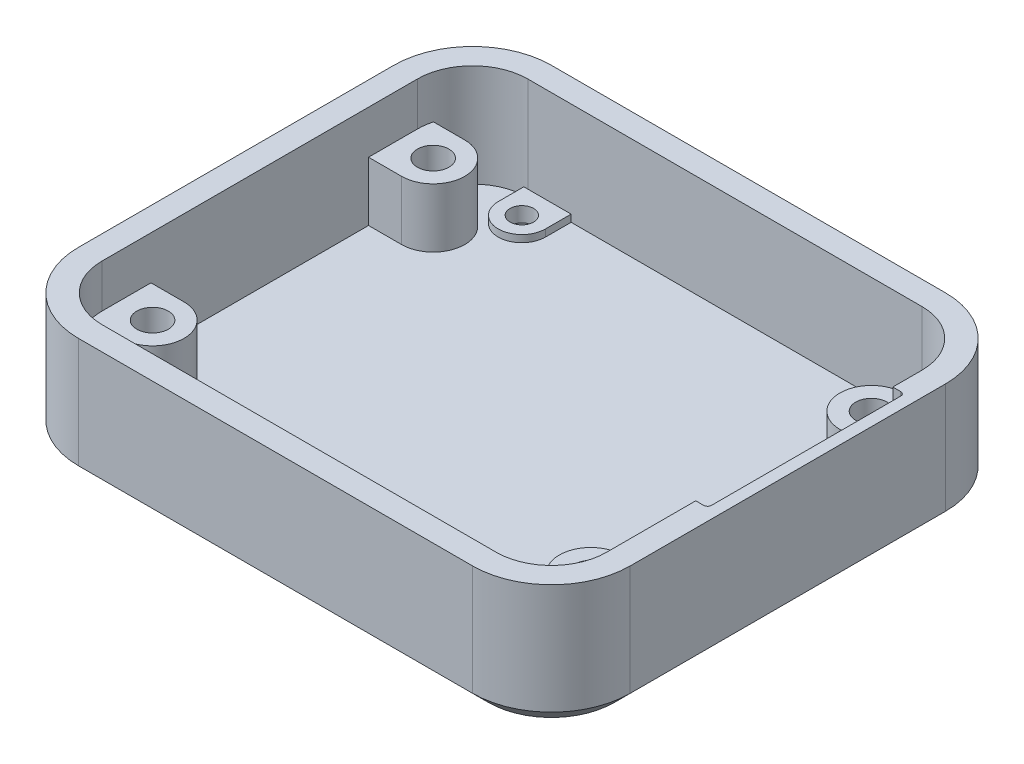
from build123d import *

# Parameters (mm, degrees)
SKETCH1_W           = 70
SKETCH1_H           = 60
BOSS_EXTRUDE1_DEPTH = 16
FILLET1_R           = 10
SHELL1_T            = -3
BOSS_EXTRUDE2_START = 7.5
SKETCH2_R           = 2
BOSS_EXTRUDE2_DEPTH = 7.5
SKETCH4_W           = 1.5
SKETCH4_H           = 25
CUT_EXTRUDE1_DEPTH  = 2
FILLET2_R           = 0.5
CHAMFER1_SIZE       = 2
CUT_EXTRUDE2_REACH  = 50.795
SKETCH5_R           = 1.5
SKETCH6_R           = 2.75
CUT_EXTRUDE3_DEPTH  = 2
SKETCH7_R           = 1.5
BOSS_EXTRUDE3_DEPTH = 0.9


with BuildPart() as part:
    # Sketch1 → Boss-Extrude1 (new body)
    with BuildSketch(Plane(origin=(0, 0, 0), x_dir=(1, 0, 0), z_dir=(0, 1, 0))):
        Rectangle(SKETCH1_W, SKETCH1_H)
    extrude(amount=BOSS_EXTRUDE1_DEPTH)

    # Fillet1
    fillet1_edges = [part.edges().sort_by_distance(p)[0] for p in [
        (-35, 8, -30),
        (35, 8, -30),
        (35, 8, 30),
        (-35, 8, 30),
    ]]
    fillet(fillet1_edges, radius=FILLET1_R)

    # Shell1
    shell1_openings = [part.faces().sort_by_distance(p)[0] for p in [
        (0, 16, 0),
    ]]
    offset(amount=SHELL1_T, openings=shell1_openings, kind=Kind.INTERSECTION)

    # Sketch2 → Boss-Extrude2 (add)
    # profile 1 of 4: a face of its own
    with BuildSketch(Plane(origin=(0, 3, 0), x_dir=(1, 0, 0), z_dir=(0, 1, 0)).offset(BOSS_EXTRUDE2_START)):
        with BuildLine():
            Line((-27.8, 21.8), (-31.76461381, 21.8))
            ThreePointArc((-31.76461381, 21.8), (-31.940904, 20.907662748), (-32, 20))
            Line((-32, 20), (-32, 13.8))
            Line((-32, 13.8), (-27.8, 13.8))
            ThreePointArc((-27.8, 13.8), (-23.8, 17.8), (-27.8, 21.8))
        make_face()
        with Locations((-27.8, 17.8)):
            Circle(SKETCH2_R, mode=Mode.SUBTRACT)
    # profile 2 of 4: a face of its own
    with BuildSketch(Plane(origin=(0, 3, 0), x_dir=(1, 0, 0), z_dir=(0, 1, 0)).offset(BOSS_EXTRUDE2_START)):
        with BuildLine():
            Line((32, -20), (32, -13.8))
            Line((32, -13.8), (27.8, -13.8))
            ThreePointArc((27.8, -13.8), (23.8, -17.8), (27.8, -21.8))
            Line((27.8, -21.8), (31.76461381, -21.8))
            ThreePointArc((31.76461381, -21.8), (31.940904, -20.907662748), (32, -20))
        make_face()
        with Locations((27.8, -17.8)):
            Circle(SKETCH2_R, mode=Mode.SUBTRACT)
    # profile 3 of 4: a face of its own
    with BuildSketch(Plane(origin=(0, 3, 0), x_dir=(1, 0, 0), z_dir=(0, 1, 0)).offset(BOSS_EXTRUDE2_START)):
        with BuildLine():
            Line((27.8, 13.8), (32, 13.8))
            Line((32, 13.8), (32, 20))
            ThreePointArc((32, 20), (31.940904, 20.907662748), (31.76461381, 21.8))
            Line((31.76461381, 21.8), (27.8, 21.8))
            ThreePointArc((27.8, 21.8), (23.8, 17.8), (27.8, 13.8))
        make_face()
        with Locations((27.8, 17.8)):
            Circle(SKETCH2_R, mode=Mode.SUBTRACT)
    # profile 4 of 4: a face of its own
    with BuildSketch(Plane(origin=(0, 3, 0), x_dir=(1, 0, 0), z_dir=(0, 1, 0)).offset(BOSS_EXTRUDE2_START)):
        with BuildLine():
            Line((-27.8, -13.8), (-32, -13.8))
            Line((-32, -13.8), (-32, -20))
            ThreePointArc((-32, -20), (-31.940904, -20.907662748), (-31.76461381, -21.8))
            Line((-31.76461381, -21.8), (-27.8, -21.8))
            ThreePointArc((-27.8, -21.8), (-23.8, -17.8), (-27.8, -13.8))
        make_face()
        with Locations((-27.8, -17.8)):
            Circle(SKETCH2_R, mode=Mode.SUBTRACT)
    extrude(amount=-BOSS_EXTRUDE2_DEPTH)

    # Sketch4 → Cut-Extrude1 (cut)
    with BuildSketch(Plane(origin=(0, 16, 0), x_dir=(1, 0, 0), z_dir=(0, 1, 0))):
        with Locations((32.75, 3.81)):
            Rectangle(SKETCH4_W, SKETCH4_H)
    extrude(amount=-CUT_EXTRUDE1_DEPTH, mode=Mode.SUBTRACT)

    # Fillet2
    fillet2_edges = [part.edges().sort_by_distance(p)[0] for p in [
        (33.5, 15, -16.31),
        (33.5, 15, 8.69),
        (32.75, 14, 8.69),
        (32.75, 14, -16.31),
    ]]
    fillet(fillet2_edges, radius=FILLET2_R)

    # Chamfer1
    chamfer1_edges = [part.edges().sort_by_distance(p)[0] for p in [
        (-32.071067812, 0, 27.071067812),
        (0, 0, 30),
        (32.071067812, 0, 27.071067812),
        (35, 0, 0),
        (32.071067812, 0, -27.071067812),
        (0, 0, -30),
        (-32.071067812, 0, -27.071067812),
        (-35, 0, 0),
    ]]
    chamfer(chamfer1_edges, length=CHAMFER1_SIZE)

    # Sketch5 → Cut-Extrude2 (cut, up to next)
    with BuildSketch(Plane.XZ, mode=Mode.PRIVATE) as cut_extrude2_sk1:
        with Locations((-22.5, 23.75)):
            Circle(SKETCH5_R)
    cut_extrude2_tool1 = extrude(cut_extrude2_sk1.sketch, amount=-CUT_EXTRUDE2_REACH, mode=Mode.PRIVATE) & part.part
    # Sketch5 → Cut-Extrude2 (cut, up to next)
    with BuildSketch(Plane.XZ, mode=Mode.PRIVATE) as cut_extrude2_sk2:
        with Locations((22.5, 23.75)):
            Circle(SKETCH5_R)
    cut_extrude2_tool2 = extrude(cut_extrude2_sk2.sketch, amount=-CUT_EXTRUDE2_REACH, mode=Mode.PRIVATE) & part.part
    # Sketch5 → Cut-Extrude2 (cut, up to next)
    with BuildSketch(Plane.XZ, mode=Mode.PRIVATE) as cut_extrude2_sk3:
        with Locations((22.5, -23.75)):
            Circle(SKETCH5_R)
    cut_extrude2_tool3 = extrude(cut_extrude2_sk3.sketch, amount=-CUT_EXTRUDE2_REACH, mode=Mode.PRIVATE) & part.part
    # Sketch5 → Cut-Extrude2 (cut, up to next)
    with BuildSketch(Plane.XZ, mode=Mode.PRIVATE) as cut_extrude2_sk4:
        with Locations((-22.5, -23.75)):
            Circle(SKETCH5_R)
    cut_extrude2_tool4 = extrude(cut_extrude2_sk4.sketch, amount=-CUT_EXTRUDE2_REACH, mode=Mode.PRIVATE) & part.part
    add(cut_extrude2_tool1.solids().sort_by_distance((-22.5, 0, 23.75))[0], mode=Mode.SUBTRACT)
    add(cut_extrude2_tool2.solids().sort_by_distance((22.5, 0, 23.75))[0], mode=Mode.SUBTRACT)
    add(cut_extrude2_tool3.solids().sort_by_distance((22.5, 0, -23.75))[0], mode=Mode.SUBTRACT)
    add(cut_extrude2_tool4.solids().sort_by_distance((-22.5, 0, -23.75))[0], mode=Mode.SUBTRACT)

    # Sketch6 → Cut-Extrude3 (cut)
    with BuildSketch(Plane.XZ):
        with Locations((-22.5, 23.75)):
            Circle(SKETCH6_R)
        with Locations((22.5, 23.75)):
            Circle(SKETCH6_R)
        with Locations((22.5, -23.75)):
            Circle(SKETCH6_R)
        with Locations((-22.5, -23.75)):
            Circle(SKETCH6_R)
    extrude(amount=-CUT_EXTRUDE3_DEPTH, mode=Mode.SUBTRACT)

    # Sketch7 → Boss-Extrude3 (add)
    # profile 1 of 4: a face of its own
    with BuildSketch(Plane(origin=(0, 3, 0), x_dir=(1, 0, 0), z_dir=(0, 1, 0))):
        with BuildLine():
            ThreePointArc((-25.5, -26.982120022), (-25.250159796, -26.995528577), (-25, -27))
            Line((-25, -27), (-19.5, -27))
            Line((-19.5, -27), (-19.5, -23.75))
            ThreePointArc((-19.5, -23.75), (-22.5, -20.75), (-25.5, -23.75))
            Line((-25.5, -23.75), (-25.5, -26.982120022))
        make_face()
        with Locations((-22.5, -23.75)):
            Circle(SKETCH7_R, mode=Mode.SUBTRACT)
    # profile 2 of 4: a face of its own
    with BuildSketch(Plane(origin=(0, 3, 0), x_dir=(1, 0, 0), z_dir=(0, 1, 0))):
        with BuildLine():
            Line((19.5, -23.75), (19.5, -27))
            Line((19.5, -27), (25, -27))
            ThreePointArc((25, -27), (25.250159796, -26.995528577), (25.5, -26.982120022))
            Line((25.5, -26.982120022), (25.5, -23.75))
            ThreePointArc((25.5, -23.75), (22.5, -20.75), (19.5, -23.75))
        make_face()
        with Locations((22.5, -23.75)):
            Circle(SKETCH7_R, mode=Mode.SUBTRACT)
    # profile 3 of 4: a face of its own
    with BuildSketch(Plane(origin=(0, 3, 0), x_dir=(1, 0, 0), z_dir=(0, 1, 0))):
        with BuildLine():
            ThreePointArc((25.5, 26.982120022), (25.250159796, 26.995528577), (25, 27))
            Line((25, 27), (19.5, 27))
            Line((19.5, 27), (19.5, 23.75))
            ThreePointArc((19.5, 23.75), (22.5, 20.75), (25.5, 23.75))
            Line((25.5, 23.75), (25.5, 26.982120022))
        make_face()
        with Locations((22.5, 23.75)):
            Circle(SKETCH7_R, mode=Mode.SUBTRACT)
    # profile 4 of 4: a face of its own
    with BuildSketch(Plane(origin=(0, 3, 0), x_dir=(1, 0, 0), z_dir=(0, 1, 0))):
        with BuildLine():
            Line((-19.5, 23.75), (-19.5, 27))
            Line((-19.5, 27), (-25, 27))
            ThreePointArc((-25, 27), (-25.250159796, 26.995528577), (-25.5, 26.982120022))
            Line((-25.5, 26.982120022), (-25.5, 23.75))
            ThreePointArc((-25.5, 23.75), (-22.5, 20.75), (-19.5, 23.75))
        make_face()
        with Locations((-22.5, 23.75)):
            Circle(SKETCH7_R, mode=Mode.SUBTRACT)
    extrude(amount=BOSS_EXTRUDE3_DEPTH)


solid = part.part
